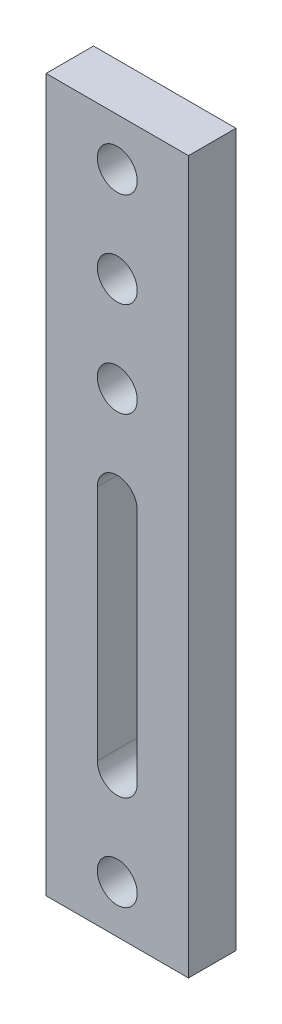
from build123d import *

# Parameters (mm, degrees)
SKETCH_1_W          = 75
SKETCH_1_H          = 375
EXTRUDE_1_DEPTH     = 25
SKETCH_2_R          = 10.5
CUT_EXTRUDE_1_DEPTH = 384.242742919


with BuildPart() as part:
    # Эскиз1 → Бобышка-Вытянуть1 (new body)
    with BuildSketch(Plane.XY):
        with Locations((37.5, 187.5)):
            Rectangle(SKETCH_1_W, SKETCH_1_H)
    extrude(amount=EXTRUDE_1_DEPTH)

    # Эскиз2 → Вырез-Вытянуть1 (cut, through all)
    with BuildSketch(Plane.XY.offset(25)):
        with Locations((37.5, 250)):
            Circle(SKETCH_2_R)
        with Locations((37.5, 300)):
            Circle(SKETCH_2_R)
        with Locations((37.5, 350)):
            Circle(SKETCH_2_R)
        with Locations((37.5, 25)):
            Circle(SKETCH_2_R)
        with BuildLine():
            Line((27, 75), (27, 200))
            ThreePointArc((27, 200), (37.5, 210.5), (48, 200))
            Line((48, 200), (48, 75))
            ThreePointArc((48, 75), (37.5, 64.5), (27, 75))
        make_face()
    extrude(amount=-CUT_EXTRUDE_1_DEPTH, mode=Mode.SUBTRACT)


solid = part.part
